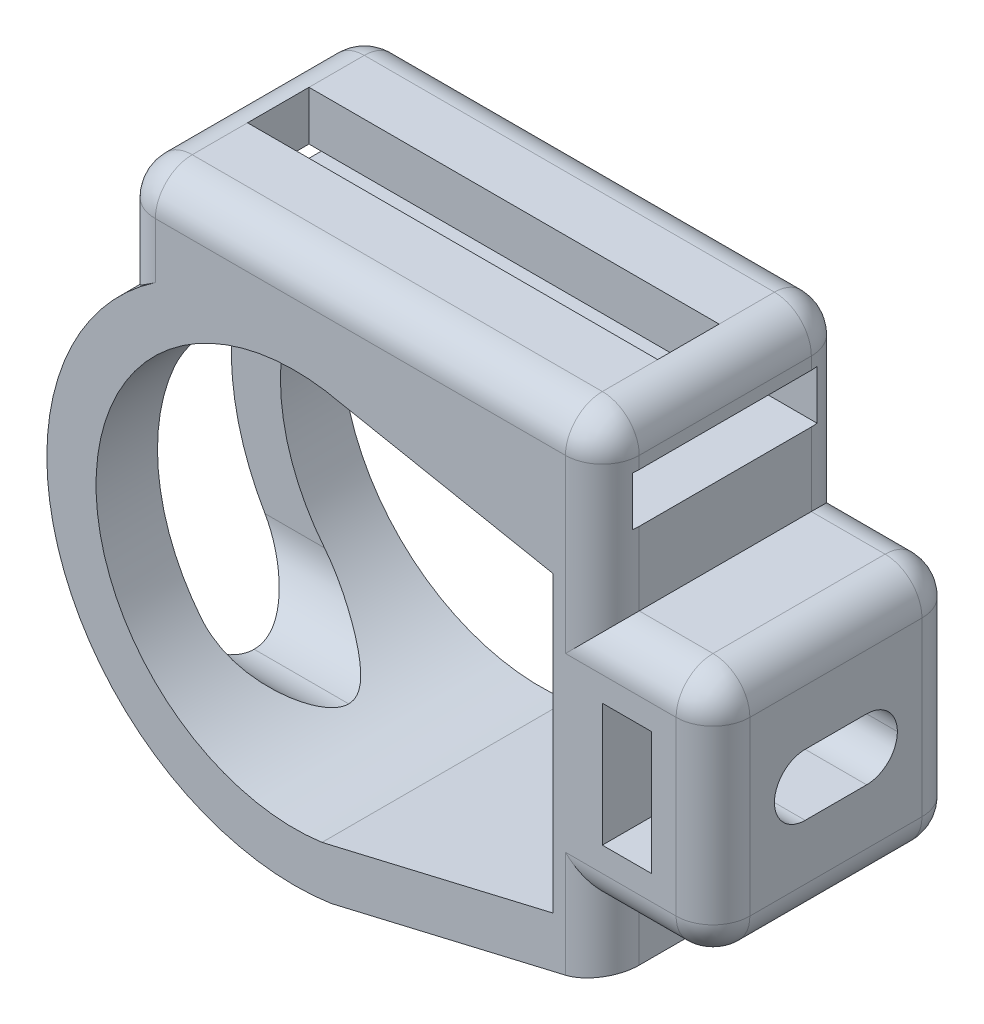
from build123d import *

# Parameters (mm, degrees)
SALIENTE_EXTRUIR1_DEPTH = 20
SALIENTE_EXTRUIR2_DEPTH = 20
CORTAR_EXTRUIR12_REACH  = 66.936
CROQUIS12_W             = 10
CROQUIS12_H             = 5
REDONDEO1_R             = 2.5
CROQUIS16_W             = 10
CROQUIS16_H             = 26.726230184
CORTAR_EXTRUIR17_DEPTH  = 20
REDONDEO2_R             = 5
CORTAR_EXTRUIR18_REACH  = 62.161
CROQUIS21_W             = 15
CROQUIS21_H             = 4
REDONDEO3_R             = 3
CROQUIS22_W             = 33.363820397
CROQUIS22_H             = 5
CORTAR_EXTRUIR20_DEPTH  = 4


# Some blends are built 0.0001 mm under size
with BuildPart() as part:
    # Croquis3 → Saliente-Extruir1 (new body)
    with BuildSketch(Plane.XY):
        with BuildLine():
            Line((-4.157247249, -24.2640649), (-26.215773458, -29.447511872))
            ThreePointArc((-26.215773458, -29.447511872), (-47.164183017, -18.638090647), (-43.521067646, 4.65154569))
            Line((-43.521067646, 4.65154569), (-43.521067646, 14.65154569))
            Line((-43.521067646, 14.65154569), (-4.157247249, 14.65154569))
            Line((-4.157247249, 14.65154569), (-4.157247249, -24.2640649))
        make_face()
        with BuildLine():
            Line((-8.157247249, 2.82108494), (-26.731262437, 6.441781026))
            ThreePointArc((-26.731262437, 6.441781026), (-45.345288804, -9.402744466), (-26.961453667, -25.513783269))
            Line((-26.961453667, -25.513783269), (-8.157247249, -21.095056202))
            Line((-8.157247249, -21.095056202), (-8.157247249, 2.82108494))
        make_face(mode=Mode.SUBTRACT)
    extrude(amount=SALIENTE_EXTRUIR1_DEPTH)

    # Croquis11 → Saliente-Extruir2 (add)
    with BuildSketch(Plane(origin=(0, 0, 0), x_dir=(-1, 0, 0), z_dir=(0, 0, -1))):
        Polygon((-4.842752751, -19.306259605), (-4.842752751, 0.693740395), (4.157247249, 0.693740395), (4.157247249, -4.306259605), (0.157247249, -4.306259605), (0.157247249, -14.306259605), (4.157247249, -14.306259605), (4.157247249, -19.306259605), align=None)
    extrude(amount=-SALIENTE_EXTRUIR2_DEPTH)

    # Cortar-Extruir12: up to this face of the body (flat: up to its plane)
    cortar_extruir12_end = Plane(part.part.faces().sort_by_distance((-8.157247249, -9.136985631, 10))[0])
    # Croquis12 → Cortar-Extruir12 (cut, up to the picked face)
    with BuildSketch(Plane(origin=(4.842752751, 0, 0), x_dir=(0, 0, -1), z_dir=(1, 0, 0)), mode=Mode.PRIVATE) as cortar_extruir12_sk1:
        with Locations((-10, -9.306259605)):
            Rectangle(CROQUIS12_W, CROQUIS12_H)
    cortar_extruir12_tool1 = split(extrude(cortar_extruir12_sk1.sketch, amount=-CORTAR_EXTRUIR12_REACH, mode=Mode.PRIVATE), bisect_by=cortar_extruir12_end, keep=Keep.BOTH, mode=Mode.PRIVATE)
    add(cortar_extruir12_tool1.solids().sort_by(Axis((4.842753, -9.30626, 10), (-1, 0, 0)))[0], mode=Mode.SUBTRACT)

    # Redondeo1
    redondeo1_edges = [part.edges().sort_by_distance(p)[0] for p in [
        (2.342752751, -6.806259605, 5),
        (2.342752751, -6.806259605, 15),
        (-6.157247249, -11.806259605, 5),
        (-6.157247249, -6.806259605, 5),
        (-6.157247249, -11.806259605, 15),
        (-6.157247249, -6.806259605, 15),
        (2.342752751, -11.806259605, 5),
        (2.342752751, -11.806259605, 15),
    ]]
    fillet(redondeo1_edges, radius=REDONDEO1_R - 0.0001)  # a hair under: the kernel refuses the full size

    # Croquis16 → Cortar-Extruir17 (cut, symmetric)
    with BuildSketch(Plane.ZY.offset(48.157247249)):
        with Locations((10, -11.305962539)):
            Rectangle(CROQUIS16_W, CROQUIS16_H)
    extrude(amount=CORTAR_EXTRUIR17_DEPTH, both=True, mode=Mode.SUBTRACT)

    # Redondeo2
    redondeo2_edges = [part.edges().sort_by_distance(p)[0] for p in [
        (-38.635693074, -24.669077631, 5),
        (-38.635693074, -24.669077631, 15),
        (-43.072694771, 2.057152553, 15),
        (-43.072694771, 2.057152553, 5),
    ]]
    fillet(redondeo2_edges, radius=REDONDEO2_R - 0.0001)  # a hair under: the kernel refuses the full size

    # Croquis21 → Cortar-Extruir18 (cut, up to next)
    with BuildSketch(Plane.ZY.offset(43.521067646), mode=Mode.PRIVATE) as cortar_extruir18_sk1:
        with Locations((10, 8.65154569)):
            Rectangle(CROQUIS21_W, CROQUIS21_H)
    cortar_extruir18_tool1 = extrude(cortar_extruir18_sk1.sketch, amount=-CORTAR_EXTRUIR18_REACH, mode=Mode.PRIVATE) & part.part
    add(cortar_extruir18_tool1.solids().sort_by_distance((-43.521068, 8.651546, 10))[0], mode=Mode.SUBTRACT)

    # Redondeo3
    # the kernel refuses this fillet: 3 mm, written as the material it takes off along each edge
    with BuildSketch(Plane(origin=(-40.521067646, 11.65154569, 3), x_dir=(-1, 0, 0), z_dir=(0, 0, -1))) as redondeo3_piece_1_section:
        Polygon((0, 0), (REDONDEO3_R * 1.02, 0), (REDONDEO3_R * 1.02, REDONDEO3_R * 1.02), (0, REDONDEO3_R * 1.02), align=None)
    redondeo3_piece_1 = extrude(amount=REDONDEO3_R * 1.02, mode=Mode.PRIVATE)
    redondeo3_piece_1 = redondeo3_piece_1 - Plane(origin=(-40.521067646, 11.65154569, 3), x_dir=(0.7071067811865506, -0.7071067811865446, 0), z_dir=(0, 0, -1)) * Sphere(REDONDEO3_R, mode=Mode.PRIVATE)
    add(redondeo3_piece_1, mode=Mode.SUBTRACT)
    with BuildSketch(Plane(origin=(-40.521067646, 11.65154569, 17), x_dir=(-1, 0, 0), z_dir=(0, 0, 1))) as redondeo3_piece_2_section:
        Polygon((0, 0), (REDONDEO3_R * 1.02, 0), (REDONDEO3_R * 1.02, -REDONDEO3_R * 1.02), (0, -REDONDEO3_R * 1.02), align=None)
    redondeo3_piece_2 = extrude(amount=REDONDEO3_R * 1.02, mode=Mode.PRIVATE)
    redondeo3_piece_2 = redondeo3_piece_2 - Plane(origin=(-40.521067646, 11.65154569, 17), x_dir=(0.7071067811865506, -0.7071067811865446, 0), z_dir=(0, 0, 1)) * Sphere(REDONDEO3_R, mode=Mode.PRIVATE)
    add(redondeo3_piece_2, mode=Mode.SUBTRACT)
    with BuildSketch(Plane(origin=(-7.157247249, 11.65154569, 3), x_dir=(0, 0, -1), z_dir=(1, 0, 0))) as redondeo3_piece_3_section:
        Polygon((0, 0), (REDONDEO3_R * 1.02, 0), (REDONDEO3_R * 1.02, REDONDEO3_R * 1.02), (0, REDONDEO3_R * 1.02), align=None)
    redondeo3_piece_3 = extrude(amount=REDONDEO3_R * 1.02, mode=Mode.PRIVATE)
    redondeo3_piece_3 = redondeo3_piece_3 - Plane(origin=(-7.157247249, 11.65154569, 3), x_dir=(0, -0.7071067811865475, 0.7071067811865475), z_dir=(1, 0, 0)) * Sphere(REDONDEO3_R, mode=Mode.PRIVATE)
    add(redondeo3_piece_3, mode=Mode.SUBTRACT)
    with BuildSketch(Plane(origin=(-7.157247249, 11.65154569, 17), x_dir=(0, 0, 1), z_dir=(1, 0, 0))) as redondeo3_piece_4_section:
        Polygon((0, 0), (REDONDEO3_R * 1.02, 0), (REDONDEO3_R * 1.02, -REDONDEO3_R * 1.02), (0, -REDONDEO3_R * 1.02), align=None)
    redondeo3_piece_4 = extrude(amount=REDONDEO3_R * 1.02, mode=Mode.PRIVATE)
    redondeo3_piece_4 = redondeo3_piece_4 - Plane(origin=(-7.157247249, 11.65154569, 17), x_dir=(0, -0.7071067811865475, -0.7071067811865475), z_dir=(1, 0, 0)) * Sphere(REDONDEO3_R, mode=Mode.PRIVATE)
    add(redondeo3_piece_4, mode=Mode.SUBTRACT)
    with BuildSketch(Plane(origin=(1.842752751, -16.306259605, 3), x_dir=(0, 0, -1), z_dir=(0, -1, 0))) as redondeo3_piece_5_section:
        Polygon((0, 0), (REDONDEO3_R * 1.02, 0), (REDONDEO3_R * 1.02, REDONDEO3_R * 1.02), (0, REDONDEO3_R * 1.02), align=None)
    redondeo3_piece_5 = extrude(amount=REDONDEO3_R * 1.02, mode=Mode.PRIVATE)
    redondeo3_piece_5 = redondeo3_piece_5 - Plane(origin=(1.842752751, -16.306259605, 3), x_dir=(-0.7071067811865475, 0, 0.7071067811865475), z_dir=(0, -1, 0)) * Sphere(REDONDEO3_R, mode=Mode.PRIVATE)
    add(redondeo3_piece_5, mode=Mode.SUBTRACT)
    with BuildSketch(Plane(origin=(1.842752751, -2.306259605, 3), x_dir=(0, 0, -1), z_dir=(0, 1, 0))) as redondeo3_piece_6_section:
        Polygon((0, 0), (REDONDEO3_R * 1.02, 0), (REDONDEO3_R * 1.02, -REDONDEO3_R * 1.02), (0, -REDONDEO3_R * 1.02), align=None)
    redondeo3_piece_6 = extrude(amount=REDONDEO3_R * 1.02, mode=Mode.PRIVATE)
    redondeo3_piece_6 = redondeo3_piece_6 - Plane(origin=(1.842752751, -2.306259605, 3), x_dir=(-0.7071067811865475, 0, 0.7071067811865475), z_dir=(0, 1, 0)) * Sphere(REDONDEO3_R, mode=Mode.PRIVATE)
    add(redondeo3_piece_6, mode=Mode.SUBTRACT)
    with BuildSketch(Plane(origin=(1.842752751, -16.306259605, 17), x_dir=(1, 0, 0), z_dir=(0, -1, 0))) as redondeo3_piece_7_section:
        Polygon((0, 0), (REDONDEO3_R * 1.02, 0), (REDONDEO3_R * 1.02, REDONDEO3_R * 1.02), (0, REDONDEO3_R * 1.02), align=None)
    redondeo3_piece_7 = extrude(amount=REDONDEO3_R * 1.02, mode=Mode.PRIVATE)
    redondeo3_piece_7 = redondeo3_piece_7 - Plane(origin=(1.842752751, -16.306259605, 17), x_dir=(-0.7071067811865475, 0, -0.7071067811865475), z_dir=(0, -1, 0)) * Sphere(REDONDEO3_R, mode=Mode.PRIVATE)
    add(redondeo3_piece_7, mode=Mode.SUBTRACT)
    with BuildSketch(Plane(origin=(1.842752751, -2.306259605, 17), x_dir=(1, 0, 0), z_dir=(0, 1, 0))) as redondeo3_piece_8_section:
        Polygon((0, 0), (REDONDEO3_R * 1.02, 0), (REDONDEO3_R * 1.02, -REDONDEO3_R * 1.02), (0, -REDONDEO3_R * 1.02), align=None)
    redondeo3_piece_8 = extrude(amount=REDONDEO3_R * 1.02, mode=Mode.PRIVATE)
    redondeo3_piece_8 = redondeo3_piece_8 - Plane(origin=(1.842752751, -2.306259605, 17), x_dir=(-0.7071067811865475, 0, -0.7071067811865475), z_dir=(0, 1, 0)) * Sphere(REDONDEO3_R, mode=Mode.PRIVATE)
    add(redondeo3_piece_8, mode=Mode.SUBTRACT)
    with BuildSketch(Plane(origin=(-43.521067646, 14.65154569, 3), x_dir=(0, -1, 0), z_dir=(0, 0, 1)), Plane(origin=(-4.157247249, 14.65154569, 3), x_dir=(-1, 0, 0), z_dir=(0, 0, 1)), Plane(origin=(4.842752751, -16.306259605, 0), x_dir=(-1, 0, 0), z_dir=(0, 1, 0)), Plane(origin=(4.842752751, -19.306259605, 3), x_dir=(0, 1, 0), z_dir=(0, 0, 1)), Plane(origin=(4.842752751, 0.693740395, 3), x_dir=(-1, 0, 0), z_dir=(0, 0, 1))) as redondeo3_piece_9:
        with BuildLine():
            CenterArc((REDONDEO3_R, REDONDEO3_R), REDONDEO3_R, 180, 90)
            Line((0, REDONDEO3_R), (-REDONDEO3_R * 0.02, REDONDEO3_R))
            Line((-REDONDEO3_R * 0.02, REDONDEO3_R), (-REDONDEO3_R * 0.02, -REDONDEO3_R * 0.02))
            Line((-REDONDEO3_R * 0.02, -REDONDEO3_R * 0.02), (REDONDEO3_R, -REDONDEO3_R * 0.02))
            Line((REDONDEO3_R, -REDONDEO3_R * 0.02), (REDONDEO3_R, 0))
        make_face()
    extrude(amount=14, mode=Mode.SUBTRACT)
    with BuildSketch(Plane(origin=(-40.521067646, 14.65154569, 0), x_dir=(0, -1, 0), z_dir=(1, 0, 0))) as redondeo3_piece_10:
        with BuildLine():
            CenterArc((REDONDEO3_R, -REDONDEO3_R), REDONDEO3_R, 90, 90)
            Line((0, -REDONDEO3_R), (-REDONDEO3_R * 0.02, -REDONDEO3_R))
            Line((-REDONDEO3_R * 0.02, -REDONDEO3_R), (-REDONDEO3_R * 0.02, REDONDEO3_R * 0.02))
            Line((-REDONDEO3_R * 0.02, REDONDEO3_R * 0.02), (REDONDEO3_R, REDONDEO3_R * 0.02))
            Line((REDONDEO3_R, REDONDEO3_R * 0.02), (REDONDEO3_R, 0))
        make_face()
    extrude(amount=33.363820397, mode=Mode.SUBTRACT)
    with BuildSketch(Plane(origin=(-40.521067646, 14.65154569, 20), x_dir=(0, -1, 0), z_dir=(1, 0, 0))) as redondeo3_piece_11:
        with BuildLine():
            CenterArc((REDONDEO3_R, REDONDEO3_R), REDONDEO3_R, 180, 90)
            Line((0, REDONDEO3_R), (-REDONDEO3_R * 0.02, REDONDEO3_R))
            Line((-REDONDEO3_R * 0.02, REDONDEO3_R), (-REDONDEO3_R * 0.02, -REDONDEO3_R * 0.02))
            Line((-REDONDEO3_R * 0.02, -REDONDEO3_R * 0.02), (REDONDEO3_R, -REDONDEO3_R * 0.02))
            Line((REDONDEO3_R, -REDONDEO3_R * 0.02), (REDONDEO3_R, 0))
        make_face()
    extrude(amount=33.363820397, mode=Mode.SUBTRACT)
    with BuildSketch(Plane(origin=(-4.157247249, -19.306259605, 20), x_dir=(0, 1, 0), z_dir=(1, 0, 0)), Plane(origin=(1.842752751, 0.693740395, 20), x_dir=(0, -1, 0), z_dir=(-1, 0, 0))) as redondeo3_piece_12:
        with BuildLine():
            CenterArc((REDONDEO3_R, -REDONDEO3_R), REDONDEO3_R, 90, 90)
            Line((0, -REDONDEO3_R), (-REDONDEO3_R * 0.02, -REDONDEO3_R))
            Line((-REDONDEO3_R * 0.02, -REDONDEO3_R), (-REDONDEO3_R * 0.02, REDONDEO3_R * 0.02))
            Line((-REDONDEO3_R * 0.02, REDONDEO3_R * 0.02), (REDONDEO3_R, REDONDEO3_R * 0.02))
            Line((REDONDEO3_R, REDONDEO3_R * 0.02), (REDONDEO3_R, 0))
        make_face()
    extrude(amount=6, mode=Mode.SUBTRACT)
    with BuildSketch(Plane(origin=(4.842752751, -16.306259605, 20), x_dir=(-1, 0, 0), z_dir=(0, 1, 0))) as redondeo3_piece_13:
        with BuildLine():
            CenterArc((REDONDEO3_R, -REDONDEO3_R), REDONDEO3_R, 90, 90)
            Line((0, -REDONDEO3_R), (-REDONDEO3_R * 0.02, -REDONDEO3_R))
            Line((-REDONDEO3_R * 0.02, -REDONDEO3_R), (-REDONDEO3_R * 0.02, REDONDEO3_R * 0.02))
            Line((-REDONDEO3_R * 0.02, REDONDEO3_R * 0.02), (REDONDEO3_R, REDONDEO3_R * 0.02))
            Line((REDONDEO3_R, REDONDEO3_R * 0.02), (REDONDEO3_R, 0))
        make_face()
    extrude(amount=14, mode=Mode.SUBTRACT)
    with BuildSketch(Plane(origin=(-4.157247249, -19.306259605, 0), x_dir=(-1, 0, 0), z_dir=(0, -1, 0))) as redondeo3_piece_14_section:
        with BuildLine():
            CenterArc((REDONDEO3_R, -REDONDEO3_R), REDONDEO3_R, 90, 90)
            Line((0, -REDONDEO3_R), (-REDONDEO3_R * 0.02, -REDONDEO3_R))
            Line((-REDONDEO3_R * 0.02, -REDONDEO3_R), (-REDONDEO3_R * 0.02, REDONDEO3_R * 0.02))
            Line((-REDONDEO3_R * 0.02, REDONDEO3_R * 0.02), (REDONDEO3_R, REDONDEO3_R * 0.02))
            Line((REDONDEO3_R, REDONDEO3_R * 0.02), (REDONDEO3_R, 0))
        make_face()
    redondeo3_piece_14 = extrude(amount=12.457805295, mode=Mode.PRIVATE)
    redondeo3_piece_14 = split(redondeo3_piece_14, bisect_by=Plane(origin=(-4.285341312, -24.294165224, 0.66783828), z_dir=(-0.228755200506403, 0.973483979447672, 0)), keep=Keep.TOP, mode=Mode.PRIVATE)
    add(redondeo3_piece_14, mode=Mode.SUBTRACT)
    with BuildSketch(Plane(origin=(-4.157247249, -19.306259605, 20), x_dir=(-1, 0, 0), z_dir=(0, -1, 0))) as redondeo3_piece_15_section:
        with BuildLine():
            CenterArc((REDONDEO3_R, REDONDEO3_R), REDONDEO3_R, 180, 90)
            Line((0, REDONDEO3_R), (-REDONDEO3_R * 0.02, REDONDEO3_R))
            Line((-REDONDEO3_R * 0.02, REDONDEO3_R), (-REDONDEO3_R * 0.02, -REDONDEO3_R * 0.02))
            Line((-REDONDEO3_R * 0.02, -REDONDEO3_R * 0.02), (REDONDEO3_R, -REDONDEO3_R * 0.02))
            Line((REDONDEO3_R, -REDONDEO3_R * 0.02), (REDONDEO3_R, 0))
        make_face()
    redondeo3_piece_15 = extrude(amount=12.457805295, mode=Mode.PRIVATE)
    redondeo3_piece_15 = split(redondeo3_piece_15, bisect_by=Plane(origin=(-4.285341312, -24.294165224, 19.33216172), z_dir=(-0.228755200506403, 0.973483979447672, 0)), keep=Keep.TOP, mode=Mode.PRIVATE)
    add(redondeo3_piece_15, mode=Mode.SUBTRACT)
    with BuildSketch(Plane(origin=(-4.157247249, -19.306259605, 0), x_dir=(0, 1, 0), z_dir=(1, 0, 0)), Plane(origin=(1.842752751, 0.693740395, 0), x_dir=(0, -1, 0), z_dir=(-1, 0, 0))) as redondeo3_piece_16:
        with BuildLine():
            CenterArc((REDONDEO3_R, REDONDEO3_R), REDONDEO3_R, 180, 90)
            Line((0, REDONDEO3_R), (-REDONDEO3_R * 0.02, REDONDEO3_R))
            Line((-REDONDEO3_R * 0.02, REDONDEO3_R), (-REDONDEO3_R * 0.02, -REDONDEO3_R * 0.02))
            Line((-REDONDEO3_R * 0.02, -REDONDEO3_R * 0.02), (REDONDEO3_R, -REDONDEO3_R * 0.02))
            Line((REDONDEO3_R, -REDONDEO3_R * 0.02), (REDONDEO3_R, 0))
        make_face()
    extrude(amount=6, mode=Mode.SUBTRACT)
    with BuildSketch(Plane(origin=(-4.157247249, 11.65154569, 0), x_dir=(-1, 0, 0), z_dir=(0, -1, 0))) as redondeo3_piece_17:
        with BuildLine():
            CenterArc((REDONDEO3_R, -REDONDEO3_R), REDONDEO3_R, 90, 90)
            Line((0, -REDONDEO3_R), (-REDONDEO3_R * 0.02, -REDONDEO3_R))
            Line((-REDONDEO3_R * 0.02, -REDONDEO3_R), (-REDONDEO3_R * 0.02, REDONDEO3_R * 0.02))
            Line((-REDONDEO3_R * 0.02, REDONDEO3_R * 0.02), (REDONDEO3_R, REDONDEO3_R * 0.02))
            Line((REDONDEO3_R, REDONDEO3_R * 0.02), (REDONDEO3_R, 0))
        make_face()
    extrude(amount=10.957805295, mode=Mode.SUBTRACT)
    with BuildSketch(Plane(origin=(-4.157247249, 11.65154569, 20), x_dir=(-1, 0, 0), z_dir=(0, -1, 0))) as redondeo3_piece_18:
        with BuildLine():
            CenterArc((REDONDEO3_R, REDONDEO3_R), REDONDEO3_R, 180, 90)
            Line((0, REDONDEO3_R), (-REDONDEO3_R * 0.02, REDONDEO3_R))
            Line((-REDONDEO3_R * 0.02, REDONDEO3_R), (-REDONDEO3_R * 0.02, -REDONDEO3_R * 0.02))
            Line((-REDONDEO3_R * 0.02, -REDONDEO3_R * 0.02), (REDONDEO3_R, -REDONDEO3_R * 0.02))
            Line((REDONDEO3_R, -REDONDEO3_R * 0.02), (REDONDEO3_R, 0))
        make_face()
    extrude(amount=10.957805295, mode=Mode.SUBTRACT)
    with BuildSketch(Plane(origin=(-43.521067646, -2.84845431, 0), x_dir=(1, 0, 0), z_dir=(0, 1, 0))) as redondeo3_piece_19_section:
        with BuildLine():
            CenterArc((REDONDEO3_R, -REDONDEO3_R), REDONDEO3_R, 90, 90)
            Line((0, -REDONDEO3_R), (-REDONDEO3_R * 0.02, -REDONDEO3_R))
            Line((-REDONDEO3_R * 0.02, -REDONDEO3_R), (-REDONDEO3_R * 0.02, REDONDEO3_R * 0.02))
            Line((-REDONDEO3_R * 0.02, REDONDEO3_R * 0.02), (REDONDEO3_R, REDONDEO3_R * 0.02))
            Line((REDONDEO3_R, REDONDEO3_R * 0.02), (REDONDEO3_R, 0))
        make_face()
    redondeo3_piece_19 = extrude(amount=14.5, mode=Mode.PRIVATE)
    redondeo3_piece_19 = redondeo3_piece_19 - Plane(origin=(-29.1957078, -9.519077631, 0.714065684), x_dir=(0.14788756041500387, -0.9890041807163904, 0), z_dir=(0, 0, -1)) * Cylinder(20.15, 42, mode=Mode.PRIVATE)
    add(redondeo3_piece_19, mode=Mode.SUBTRACT)
    with BuildSketch(Plane(origin=(-43.521067646, -2.84845431, 20), x_dir=(1, 0, 0), z_dir=(0, 1, 0))) as redondeo3_piece_20_section:
        with BuildLine():
            CenterArc((REDONDEO3_R, REDONDEO3_R), REDONDEO3_R, 180, 90)
            Line((0, REDONDEO3_R), (-REDONDEO3_R * 0.02, REDONDEO3_R))
            Line((-REDONDEO3_R * 0.02, REDONDEO3_R), (-REDONDEO3_R * 0.02, -REDONDEO3_R * 0.02))
            Line((-REDONDEO3_R * 0.02, -REDONDEO3_R * 0.02), (REDONDEO3_R, -REDONDEO3_R * 0.02))
            Line((REDONDEO3_R, -REDONDEO3_R * 0.02), (REDONDEO3_R, 0))
        make_face()
    redondeo3_piece_20 = extrude(amount=14.5, mode=Mode.PRIVATE)
    redondeo3_piece_20 = redondeo3_piece_20 - Plane(origin=(-29.1957078, -9.519077631, 19.285934316), x_dir=(0.14788756041500387, -0.9890041807163904, 0), z_dir=(0, 0, -1)) * Cylinder(20.15, 42, mode=Mode.PRIVATE)
    add(redondeo3_piece_20, mode=Mode.SUBTRACT)
    with BuildSketch(Plane(origin=(-11.657247249, -19.306259605, 20), x_dir=(0, 1, 0), z_dir=(1, 0, 0))) as redondeo3_piece_21a_section:
        with BuildLine():
            CenterArc((REDONDEO3_R, -REDONDEO3_R), REDONDEO3_R, 90, 90)
            Line((0, -REDONDEO3_R), (-REDONDEO3_R * 0.02, -REDONDEO3_R))
            Line((-REDONDEO3_R * 0.02, -REDONDEO3_R), (-REDONDEO3_R * 0.02, REDONDEO3_R * 0.02))
            Line((-REDONDEO3_R * 0.02, REDONDEO3_R * 0.02), (REDONDEO3_R, REDONDEO3_R * 0.02))
            Line((REDONDEO3_R, REDONDEO3_R * 0.02), (REDONDEO3_R, 0))
        make_face()
    redondeo3_piece_21a = extrude(amount=13.5, mode=Mode.PRIVATE)
    redondeo3_piece_21a = split(redondeo3_piece_21a, bisect_by=Plane(origin=(-4.157247249, -18.627074262, 19.320814657), z_dir=(-1, 0, 0)), keep=Keep.TOP, mode=Mode.PRIVATE)
    with BuildSketch(Plane(origin=(-4.157247249, -11.806259605, 20), x_dir=(-1, 0, 0), z_dir=(0, -1, 0))) as redondeo3_piece_21b_section:
        with BuildLine():
            CenterArc((REDONDEO3_R, REDONDEO3_R), REDONDEO3_R, 180, 90)
            Line((0, REDONDEO3_R), (-REDONDEO3_R * 0.02, REDONDEO3_R))
            Line((-REDONDEO3_R * 0.02, REDONDEO3_R), (-REDONDEO3_R * 0.02, -REDONDEO3_R * 0.02))
            Line((-REDONDEO3_R * 0.02, -REDONDEO3_R * 0.02), (REDONDEO3_R, -REDONDEO3_R * 0.02))
            Line((REDONDEO3_R, -REDONDEO3_R * 0.02), (REDONDEO3_R, 0))
        make_face()
    redondeo3_piece_21b = extrude(amount=19.957805295, mode=Mode.PRIVATE)
    redondeo3_piece_21b = split(redondeo3_piece_21b, bisect_by=Plane(origin=(-4.836432592, -19.306259605, 19.320814657), z_dir=(0, 1, 0)), keep=Keep.TOP, mode=Mode.PRIVATE)
    redondeo3_piece_21 = redondeo3_piece_21a & redondeo3_piece_21b
    add(redondeo3_piece_21, mode=Mode.SUBTRACT)
    with BuildSketch(Plane(origin=(-4.157247249, 11.65154569, 20), x_dir=(-1, 0, 0), z_dir=(0, -1, 0))) as redondeo3_piece_22a_section:
        with BuildLine():
            CenterArc((REDONDEO3_R, REDONDEO3_R), REDONDEO3_R, 180, 90)
            Line((0, REDONDEO3_R), (-REDONDEO3_R * 0.02, REDONDEO3_R))
            Line((-REDONDEO3_R * 0.02, REDONDEO3_R), (-REDONDEO3_R * 0.02, -REDONDEO3_R * 0.02))
            Line((-REDONDEO3_R * 0.02, -REDONDEO3_R * 0.02), (REDONDEO3_R, -REDONDEO3_R * 0.02))
            Line((REDONDEO3_R, -REDONDEO3_R * 0.02), (REDONDEO3_R, 0))
        make_face()
    redondeo3_piece_22a = extrude(amount=18.457805295, mode=Mode.PRIVATE)
    redondeo3_piece_22a = split(redondeo3_piece_22a, bisect_by=Plane(origin=(-4.836432592, 0.693740395, 19.320814657), z_dir=(0, -1, 0)), keep=Keep.TOP, mode=Mode.PRIVATE)
    with BuildSketch(Plane(origin=(1.842752751, 0.693740395, 20), x_dir=(0, -1, 0), z_dir=(-1, 0, 0))) as redondeo3_piece_22b_section:
        with BuildLine():
            CenterArc((REDONDEO3_R, -REDONDEO3_R), REDONDEO3_R, 90, 90)
            Line((0, -REDONDEO3_R), (-REDONDEO3_R * 0.02, -REDONDEO3_R))
            Line((-REDONDEO3_R * 0.02, -REDONDEO3_R), (-REDONDEO3_R * 0.02, REDONDEO3_R * 0.02))
            Line((-REDONDEO3_R * 0.02, REDONDEO3_R * 0.02), (REDONDEO3_R, REDONDEO3_R * 0.02))
            Line((REDONDEO3_R, REDONDEO3_R * 0.02), (REDONDEO3_R, 0))
        make_face()
    redondeo3_piece_22b = extrude(amount=13.5, mode=Mode.PRIVATE)
    redondeo3_piece_22b = split(redondeo3_piece_22b, bisect_by=Plane(origin=(-4.157247249, 0.014555052, 19.320814657), z_dir=(-1, 0, 0)), keep=Keep.TOP, mode=Mode.PRIVATE)
    redondeo3_piece_22 = redondeo3_piece_22a & redondeo3_piece_22b
    add(redondeo3_piece_22, mode=Mode.SUBTRACT)
    with BuildSketch(Plane(origin=(-11.657247249, -19.306259605, 0), x_dir=(0, 1, 0), z_dir=(1, 0, 0))) as redondeo3_piece_23a_section:
        with BuildLine():
            CenterArc((REDONDEO3_R, REDONDEO3_R), REDONDEO3_R, 180, 90)
            Line((0, REDONDEO3_R), (-REDONDEO3_R * 0.02, REDONDEO3_R))
            Line((-REDONDEO3_R * 0.02, REDONDEO3_R), (-REDONDEO3_R * 0.02, -REDONDEO3_R * 0.02))
            Line((-REDONDEO3_R * 0.02, -REDONDEO3_R * 0.02), (REDONDEO3_R, -REDONDEO3_R * 0.02))
            Line((REDONDEO3_R, -REDONDEO3_R * 0.02), (REDONDEO3_R, 0))
        make_face()
    redondeo3_piece_23a = extrude(amount=13.5, mode=Mode.PRIVATE)
    redondeo3_piece_23a = split(redondeo3_piece_23a, bisect_by=Plane(origin=(-4.157247249, -18.627074262, 0.679185343), z_dir=(-1, 0, 0)), keep=Keep.TOP, mode=Mode.PRIVATE)
    with BuildSketch(Plane(origin=(-4.157247249, -11.806259605, 0), x_dir=(-1, 0, 0), z_dir=(0, -1, 0))) as redondeo3_piece_23b_section:
        with BuildLine():
            CenterArc((REDONDEO3_R, -REDONDEO3_R), REDONDEO3_R, 90, 90)
            Line((0, -REDONDEO3_R), (-REDONDEO3_R * 0.02, -REDONDEO3_R))
            Line((-REDONDEO3_R * 0.02, -REDONDEO3_R), (-REDONDEO3_R * 0.02, REDONDEO3_R * 0.02))
            Line((-REDONDEO3_R * 0.02, REDONDEO3_R * 0.02), (REDONDEO3_R, REDONDEO3_R * 0.02))
            Line((REDONDEO3_R, REDONDEO3_R * 0.02), (REDONDEO3_R, 0))
        make_face()
    redondeo3_piece_23b = extrude(amount=19.957805295, mode=Mode.PRIVATE)
    redondeo3_piece_23b = split(redondeo3_piece_23b, bisect_by=Plane(origin=(-4.836432592, -19.306259605, 0.679185343), z_dir=(0, 1, 0)), keep=Keep.TOP, mode=Mode.PRIVATE)
    redondeo3_piece_23 = redondeo3_piece_23a & redondeo3_piece_23b
    add(redondeo3_piece_23, mode=Mode.SUBTRACT)
    with BuildSketch(Plane(origin=(-4.157247249, 11.65154569, 0), x_dir=(-1, 0, 0), z_dir=(0, -1, 0))) as redondeo3_piece_24a_section:
        with BuildLine():
            CenterArc((REDONDEO3_R, -REDONDEO3_R), REDONDEO3_R, 90, 90)
            Line((0, -REDONDEO3_R), (-REDONDEO3_R * 0.02, -REDONDEO3_R))
            Line((-REDONDEO3_R * 0.02, -REDONDEO3_R), (-REDONDEO3_R * 0.02, REDONDEO3_R * 0.02))
            Line((-REDONDEO3_R * 0.02, REDONDEO3_R * 0.02), (REDONDEO3_R, REDONDEO3_R * 0.02))
            Line((REDONDEO3_R, REDONDEO3_R * 0.02), (REDONDEO3_R, 0))
        make_face()
    redondeo3_piece_24a = extrude(amount=18.457805295, mode=Mode.PRIVATE)
    redondeo3_piece_24a = split(redondeo3_piece_24a, bisect_by=Plane(origin=(-4.836432592, 0.693740395, 0.679185343), z_dir=(0, -1, 0)), keep=Keep.TOP, mode=Mode.PRIVATE)
    with BuildSketch(Plane(origin=(1.842752751, 0.693740395, 0), x_dir=(0, -1, 0), z_dir=(-1, 0, 0))) as redondeo3_piece_24b_section:
        with BuildLine():
            CenterArc((REDONDEO3_R, REDONDEO3_R), REDONDEO3_R, 180, 90)
            Line((0, REDONDEO3_R), (-REDONDEO3_R * 0.02, REDONDEO3_R))
            Line((-REDONDEO3_R * 0.02, REDONDEO3_R), (-REDONDEO3_R * 0.02, -REDONDEO3_R * 0.02))
            Line((-REDONDEO3_R * 0.02, -REDONDEO3_R * 0.02), (REDONDEO3_R, -REDONDEO3_R * 0.02))
            Line((REDONDEO3_R, -REDONDEO3_R * 0.02), (REDONDEO3_R, 0))
        make_face()
    redondeo3_piece_24b = extrude(amount=13.5, mode=Mode.PRIVATE)
    redondeo3_piece_24b = split(redondeo3_piece_24b, bisect_by=Plane(origin=(-4.157247249, 0.014555052, 0.679185343), z_dir=(-1, 0, 0)), keep=Keep.TOP, mode=Mode.PRIVATE)
    redondeo3_piece_24 = redondeo3_piece_24a & redondeo3_piece_24b
    add(redondeo3_piece_24, mode=Mode.SUBTRACT)

    # Croquis22 → Cortar-Extruir20 (cut)
    with BuildSketch(Plane(origin=(0, 14.65154569, 0), x_dir=(1, 0, 0), z_dir=(0, 1, 0))):
        with Locations((-23.839157448, -10)):
            Rectangle(CROQUIS22_W, CROQUIS22_H)
    extrude(amount=-CORTAR_EXTRUIR20_DEPTH, mode=Mode.SUBTRACT)


solid = part.part
